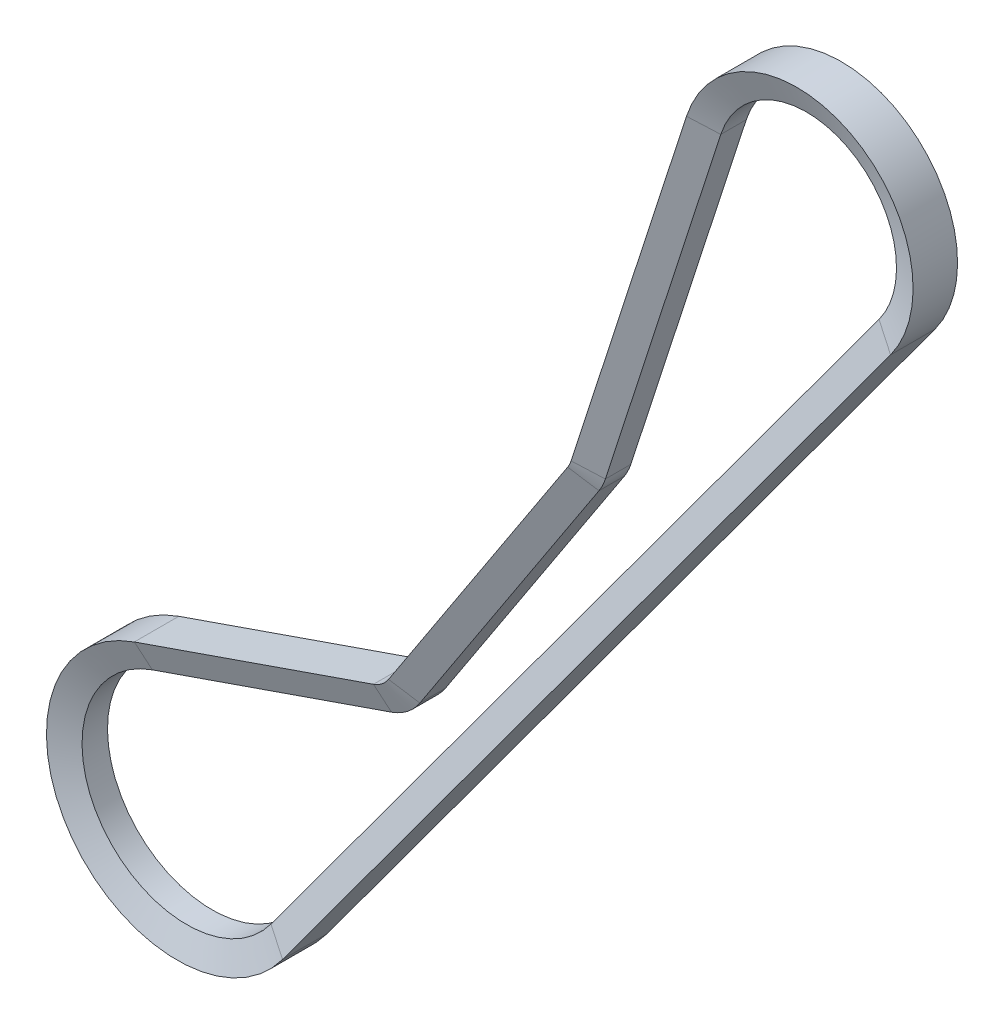
from build123d import *


with BuildPart() as part:
    # Sweep1: sweep along a path in Sketch2
    with BuildLine(Plane.XY) as sweep1_path:
        Line((20.046762974, -14.727284914), (-110.1914599, -192.007401334))
        ThreePointArc((-110.1914599, -192.007401334), (-155.290612171, -192.049853268), (-141.929814443, -148.975215465))
        Line((-141.929814443, -148.975215465), (-90.707626423, -131.213973856))
        ThreePointArc((-90.707626423, -131.213973856), (-88.883107418, -130.221868684), (-87.476276148, -128.694135706))
        Line((-87.476276148, -128.694135706), (-49.117170636, -70.140066468))
        ThreePointArc((-49.117170636, -70.140066468), (-48.701906397, -69.403427751), (-48.388204227, -68.618143131))
        Line((-48.388204227, -68.618143131), (-23.663203541, 7.669317106))
        ThreePointArc((-23.663203541, 7.669317106), (11.343350744, 22.138067228), (20.046762974, -14.727284914))
    # Sketch3 → Sweep1 (sweep)
    with BuildSketch(Plane(origin=(-23.663203541, 7.669317106, 0), x_dir=(0.9512845631569526, -0.3083142551022995, 0), z_dir=(0.3083142551022995, 0.9512845631569526, 0))):
        Polygon((0, -4.7625), (0, 4.7625), (5.588, 2.728634331), (5.588, -2.728634331), align=None)
    sweep(path=sweep1_path.line)


solid = part.part
